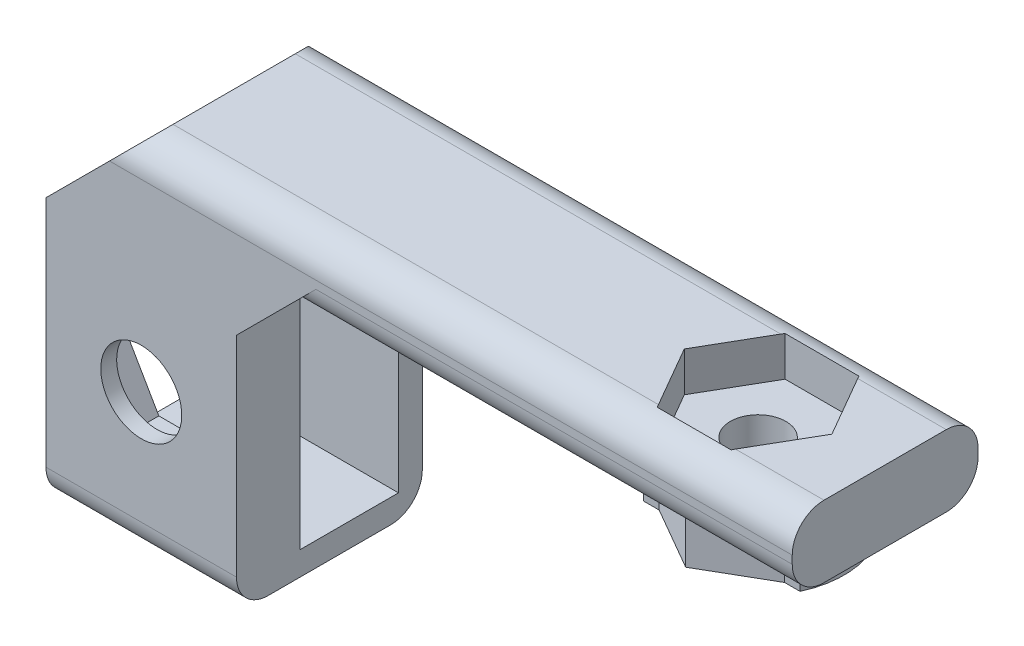
from build123d import *

# Parameters (mm, degrees)
SKETCH1_R           = 1.75
BOSS_EXTRUDE1_DEPTH = 2.8
SKETCH2_W           = 47
SKETCH2_H           = 11.7
BOSS_EXTRUDE2_DEPTH = 4.5
SKETCH2_4_R         = 1.75
BOSS_EXTRUDE3_DEPTH = 2
SKETCH3_W           = 12
SKETCH3_H           = 11.7
BOSS_EXTRUDE4_DEPTH = 18.2
SKETCH4_W           = 6.2
SKETCH4_H           = 15.2
CUT_EXTRUDE2_DEPTH  = 17.2
SKETCH5_R           = 2.55
CUT_EXTRUDE4_DEPTH  = 3
SKETCH5_2_R         = 2.55
CUT_EXTRUDE5_DEPTH  = 43.631561079
FILLET1_R           = 2
CHAMFER1_SIZE       = 3
FILLET2_R           = 2
CHAMFER2_SIZE       = 6


with BuildPart() as part:
    # Sketch1 → Boss-Extrude1 (new body)
    with BuildSketch(Plane(origin=(0, 0, 0), x_dir=(1, 0, 0), z_dir=(0, 1, 0))):
        with BuildLine():
            Line((-3.95, 2.280533563), (-4.922376628, 2.280533563))
            ThreePointArc((-4.922376628, 2.280533563), (-5.425, 0), (-4.922376628, -2.280533563))
            Line((-4.922376628, -2.280533563), (-3.95, -2.280533563))
            Line((-3.95, -2.280533563), (0, -4.561067127))
            Line((0, -4.561067127), (3.95, -2.280533563))
            Line((3.95, -2.280533563), (4.922376628, -2.280533563))
            ThreePointArc((4.922376628, -2.280533563), (5.425, 0), (4.922376628, 2.280533563))
            Line((4.922376628, 2.280533563), (3.95, 2.280533563))
            Line((3.95, 2.280533563), (0, 4.561067127))
            Line((0, 4.561067127), (-3.95, 2.280533563))
        make_face()
        with Locations(Location((0, 0, 0), (0, 0, 270))):
            Circle(SKETCH1_R, mode=Mode.SUBTRACT)
    extrude(amount=BOSS_EXTRUDE1_DEPTH)

    # Sketch2 → Boss-Extrude2 (add)
    with BuildSketch(Plane(origin=(0, 2.8, 0), x_dir=(1, 0, 0), z_dir=(0, 1, 0))):
        with Locations((-15.5, 0)):
            Rectangle(SKETCH2_W, SKETCH2_H)
        Polygon((4.647669667, 0), (2.323834833, 4.025), (-2.323834833, 4.025), (-4.647669667, 0), (-2.323834833, -4.025), (2.323834833, -4.025), align=None, mode=Mode.SUBTRACT)
    extrude(amount=BOSS_EXTRUDE2_DEPTH)

    # Sketch2<4> → Boss-Extrude3 (add)
    # profile 1 of 5: a face of its own
    with BuildSketch(Plane(origin=(0, 2.8, 0), x_dir=(1, 0, 0), z_dir=(0, 1, 0))):
        Polygon((0.9284955, 4.025), (3.0215045, 2.81660069), (2.323834833, 4.025), align=None)
    # profile 2 of 5: a face of its own
    with BuildSketch(Plane(origin=(0, 2.8, 0), x_dir=(1, 0, 0), z_dir=(0, 1, 0))):
        Polygon((3.0215045, -2.81660069), (4.647669667, 0), (3.0215045, 2.81660069), (0.9284955, 4.025), (-0.9284955, 4.025), (-3.0215045, 2.81660069), (-4.647669667, 0), (-3.0215045, -2.81660069), (-0.9284955, -4.025), (0.9284955, -4.025), align=None)
        with Locations(Location((0, 0, 0), (0, 0, 270))):
            Circle(SKETCH2_4_R, mode=Mode.SUBTRACT)
    # profile 3 of 5: a face of its own
    with BuildSketch(Plane(origin=(0, 2.8, 0), x_dir=(1, 0, 0), z_dir=(0, 1, 0))):
        Polygon((2.323834833, -4.025), (3.0215045, -2.81660069), (0.9284955, -4.025), align=None)
    # profile 4 of 5: a face of its own
    with BuildSketch(Plane(origin=(0, 2.8, 0), x_dir=(1, 0, 0), z_dir=(0, 1, 0))):
        Polygon((-2.323834833, -4.025), (-0.9284955, -4.025), (-3.0215045, -2.81660069), align=None)
    # profile 5 of 5: a face of its own
    with BuildSketch(Plane(origin=(0, 2.8, 0), x_dir=(1, 0, 0), z_dir=(0, 1, 0))):
        Polygon((-3.0215045, 2.81660069), (-0.9284955, 4.025), (-2.323834833, 4.025), align=None)
    extrude(amount=BOSS_EXTRUDE3_DEPTH)

    # Sketch3 → Boss-Extrude4 (add)
    with BuildSketch(Plane.XZ.offset(-2.8)):
        with Locations((-33, 0)):
            Rectangle(SKETCH3_W, SKETCH3_H)
    extrude(amount=BOSS_EXTRUDE4_DEPTH)

    # Sketch4 → Cut-Extrude2 (cut)
    with BuildSketch(Plane.ZY.offset(39)):
        with Locations((-1.25, -6.3)):
            Rectangle(SKETCH4_W, SKETCH4_H)
    extrude(amount=-CUT_EXTRUDE2_DEPTH, mode=Mode.SUBTRACT)

    # Sketch5 → Cut-Extrude4 (cut)
    with BuildSketch(Plane(origin=(0, 0, 1.85), x_dir=(-1, 0, 0), z_dir=(0, 0, -1))):
        Polygon((38.634973236, -6.3), (35.892559458, -1.55), (30.4077319, -1.55), (27.665318122, -6.3), (30.4077319, -11.05), (35.892559458, -11.05), align=None)
        with Locations(Location((33, -6.3, 0), (0, 0, 90))):
            Circle(SKETCH5_R, mode=Mode.SUBTRACT)
    extrude(amount=-CUT_EXTRUDE4_DEPTH, mode=Mode.SUBTRACT)

    # Sketch5<2> → Cut-Extrude5 (cut, through all)
    with BuildSketch(Plane(origin=(0, 0, 1.85), x_dir=(-1, 0, 0), z_dir=(0, 0, -1))):
        with Locations(Location((33, -6.3, 0), (0, 0, 90))):
            Circle(SKETCH5_2_R)
    extrude(amount=-CUT_EXTRUDE5_DEPTH, mode=Mode.SUBTRACT)

    # Fillet1
    # the kernel refuses this fillet: 2 mm, written as the material it takes off along each edge
    with BuildSketch(Plane(origin=(-22, -15.4, 5.85), x_dir=(0, 1, 0), z_dir=(-1, 0, 0)), Plane(origin=(-44, -15.4, -5.85), x_dir=(0, 1, 0), z_dir=(1, 0, 0))) as fillet1_piece_1:
        with BuildLine():
            CenterArc((FILLET1_R, FILLET1_R), FILLET1_R, 180, 90)
            Line((0, FILLET1_R), (0, 0))
            Line((0, 0), (FILLET1_R, 0))
        make_face()
    extrude(amount=22, mode=Mode.SUBTRACT)
    with BuildSketch(Plane(origin=(-44, 7.3, 5.85), x_dir=(0, -1, 0), z_dir=(1, 0, 0)), Plane(origin=(13, 7.3, -5.85), x_dir=(0, -1, 0), z_dir=(-1, 0, 0))) as fillet1_piece_2:
        with BuildLine():
            CenterArc((FILLET1_R, FILLET1_R), FILLET1_R, 180, 90)
            Line((0, FILLET1_R), (0, 0))
            Line((0, 0), (FILLET1_R, 0))
        make_face()
    extrude(amount=57, mode=Mode.SUBTRACT)

    # Chamfer1
    # the kernel refuses this chamfer: 3 mm, written as the material it adds along each edge
    with BuildSketch(Plane(origin=(-27, 2.8, -5.85), x_dir=(0.9996219169112968, 0.027495876610586334, 0), z_dir=(0, 0, 1))) as chamfer1_piece_1_section:
        Polygon((CHAMFER1_SIZE * 0.999621916911, -CHAMFER1_SIZE * 0.0274958766106), (-CHAMFER1_SIZE * 0.0274958766106, -CHAMFER1_SIZE * 0.999621916911), (0, 0), align=None)
    chamfer1_piece_1 = extrude(amount=11.7, mode=Mode.PRIVATE)
    chamfer1_piece_1 = split(chamfer1_piece_1, bisect_by=Plane(origin=(-25.819796748, 1.3, -5.1), z_dir=(0, 1, 0)), keep=Keep.TOP, mode=Mode.PRIVATE)
    chamfer1_piece_1 = split(chamfer1_piece_1, bisect_by=Plane(origin=(-25.819796748, 2.175297131, -4.35), z_dir=(0, 0, -1)), keep=Keep.TOP, mode=Mode.PRIVATE)
    add(chamfer1_piece_1)
    with BuildSketch(Plane(origin=(-27, 2.8, -5.85), x_dir=(0.9996219169112968, 0.027495876610586334, 0), z_dir=(0, 0, 1))) as chamfer1_piece_2_section:
        Polygon((CHAMFER1_SIZE * 0.999621916911, -CHAMFER1_SIZE * 0.0274958766106), (-CHAMFER1_SIZE * 0.0274958766106, -CHAMFER1_SIZE * 0.999621916911), (0, 0), align=None)
    chamfer1_piece_2 = extrude(amount=11.7, mode=Mode.PRIVATE)
    chamfer1_piece_2 = split(chamfer1_piece_2, bisect_by=Plane(origin=(-26.56328803, 1.3, -5.1), z_dir=(0, -1, 0)), keep=Keep.TOP, mode=Mode.PRIVATE)
    chamfer1_piece_2 = split(chamfer1_piece_2, bisect_by=Plane(origin=(-26.56328803, 0.754421165, -4.35), z_dir=(0, 0, -1)), keep=Keep.TOP, mode=Mode.PRIVATE)
    add(chamfer1_piece_2)
    with BuildSketch(Plane(origin=(-27, 2.8, -5.85), x_dir=(0.9996219169112968, 0.027495876610586334, 0), z_dir=(0, 0, 1))) as chamfer1_piece_3_section:
        Polygon((CHAMFER1_SIZE * 0.999621916911, -CHAMFER1_SIZE * 0.0274958766106), (-CHAMFER1_SIZE * 0.0274958766106, -CHAMFER1_SIZE * 0.999621916911), (0, 0), align=None)
    chamfer1_piece_3 = extrude(amount=11.7, mode=Mode.PRIVATE)
    chamfer1_piece_3 = split(chamfer1_piece_3, bisect_by=Plane(origin=(-25.819796748, 1.3, -1.25), z_dir=(0, 1, 0)), keep=Keep.TOP, mode=Mode.PRIVATE)
    chamfer1_piece_3 = split(chamfer1_piece_3, bisect_by=Plane(origin=(-25.819796748, 2.175297131, 1.85), z_dir=(0, 0, -1)), keep=Keep.TOP, mode=Mode.PRIVATE)
    chamfer1_piece_3 = split(chamfer1_piece_3, bisect_by=Plane(origin=(-25.819796748, 2.175297131, -4.35), z_dir=(0, 0, 1)), keep=Keep.TOP, mode=Mode.PRIVATE)
    add(chamfer1_piece_3)
    with BuildSketch(Plane(origin=(-27, 2.8, -5.85), x_dir=(0.9996219169112968, 0.027495876610586334, 0), z_dir=(0, 0, 1))) as chamfer1_piece_4_section:
        Polygon((CHAMFER1_SIZE * 0.999621916911, -CHAMFER1_SIZE * 0.0274958766106), (-CHAMFER1_SIZE * 0.0274958766106, -CHAMFER1_SIZE * 0.999621916911), (0, 0), align=None)
    chamfer1_piece_4 = extrude(amount=11.7, mode=Mode.PRIVATE)
    chamfer1_piece_4 = split(chamfer1_piece_4, bisect_by=Plane(origin=(-25.819796748, 1.3, 3.85), z_dir=(0, 1, 0)), keep=Keep.TOP, mode=Mode.PRIVATE)
    chamfer1_piece_4 = split(chamfer1_piece_4, bisect_by=Plane(origin=(-25.819796748, 2.175297131, 1.85), z_dir=(0, 0, 1)), keep=Keep.TOP, mode=Mode.PRIVATE)
    add(chamfer1_piece_4)
    with BuildSketch(Plane(origin=(-27, 2.8, -5.85), x_dir=(0.9996219169112968, 0.027495876610586334, 0), z_dir=(0, 0, 1))) as chamfer1_piece_5_section:
        Polygon((CHAMFER1_SIZE * 0.999621916911, -CHAMFER1_SIZE * 0.0274958766106), (-CHAMFER1_SIZE * 0.0274958766106, -CHAMFER1_SIZE * 0.999621916911), (0, 0), align=None)
    chamfer1_piece_5 = extrude(amount=11.7, mode=Mode.PRIVATE)
    chamfer1_piece_5 = split(chamfer1_piece_5, bisect_by=Plane(origin=(-26.56328803, 1.3, 3.85), z_dir=(0, -1, 0)), keep=Keep.TOP, mode=Mode.PRIVATE)
    chamfer1_piece_5 = split(chamfer1_piece_5, bisect_by=Plane(origin=(-26.56328803, 0.754421165, 1.85), z_dir=(0, 0, 1)), keep=Keep.TOP, mode=Mode.PRIVATE)
    add(chamfer1_piece_5)

    # Fillet2
    # the kernel refuses this fillet: 2 mm, written as the material it takes off along each edge
    with BuildSketch(Plane(origin=(-29, 2.8, 5.85), x_dir=(0, 1, 0), z_dir=(1, 0, 0))) as fillet2_piece_1_section:
        with BuildLine():
            CenterArc((FILLET2_R, -FILLET2_R), FILLET2_R, 90, 90)
            Line((0, -FILLET2_R), (0, 0))
            Line((0, 0), (FILLET2_R, 0))
        make_face()
    fillet2_piece_1 = extrude(amount=42, mode=Mode.PRIVATE)
    fillet2_piece_1 = split(fillet2_piece_1, bisect_by=Plane(origin=(-18.041164539, 8.758835461, 5.380594006), z_dir=(0.7071067811868302, -0.7071067811862648, 0)), keep=Keep.TOP, mode=Mode.PRIVATE)
    fillet2_piece_1 = split(fillet2_piece_1, bisect_by=Plane(origin=(-9.744227799, 3.236820588, 10.186899669), z_dir=(-0.5, 0, -0.8660254037844387)), keep=Keep.TOP, mode=Mode.PRIVATE)
    fillet2_piece_1 = split(fillet2_piece_1, bisect_by=Plane(origin=(-9.034496702, 3.236820588, -0.655001976), z_dir=(-0.4999999999999998, 0, 0.8660254037844388)), keep=Keep.TOP, mode=Mode.PRIVATE)
    add(fillet2_piece_1, mode=Mode.SUBTRACT)
    with BuildSketch(Plane(origin=(-29, 2.8, 5.85), x_dir=(0, 1, 0), z_dir=(1, 0, 0))) as fillet2_piece_2_section:
        with BuildLine():
            CenterArc((FILLET2_R, -FILLET2_R), FILLET2_R, 90, 90)
            Line((0, -FILLET2_R), (0, 0))
            Line((0, 0), (FILLET2_R, 0))
        make_face()
    fillet2_piece_2 = extrude(amount=42, mode=Mode.PRIVATE)
    fillet2_piece_2 = split(fillet2_piece_2, bisect_by=Plane(origin=(-0.44699773, 3.373635394, 4.819141386), z_dir=(0.5, 0, 0.8660254037844387)), keep=Keep.TOP, mode=Mode.PRIVATE)
    fillet2_piece_2 = split(fillet2_piece_2, bisect_by=Plane(origin=(0.44699773, 3.373635394, 4.819141386), z_dir=(-0.4999999999999998, 0, 0.8660254037844388)), keep=Keep.TOP, mode=Mode.PRIVATE)
    add(fillet2_piece_2, mode=Mode.SUBTRACT)
    with BuildSketch(Plane(origin=(-29, 2.8, 5.85), x_dir=(0, 1, 0), z_dir=(1, 0, 0))) as fillet2_piece_3_section:
        with BuildLine():
            CenterArc((FILLET2_R, -FILLET2_R), FILLET2_R, 90, 90)
            Line((0, -FILLET2_R), (0, 0))
            Line((0, 0), (FILLET2_R, 0))
        make_face()
    fillet2_piece_3 = extrude(amount=42, mode=Mode.PRIVATE)
    fillet2_piece_3 = split(fillet2_piece_3, bisect_by=Plane(origin=(5.072316414, 3.23833996, 1.632563879), z_dir=(0.5, 0, 0.8660254037844387)), keep=Keep.TOP, mode=Mode.PRIVATE)
    fillet2_piece_3 = split(fillet2_piece_3, bisect_by=Plane(origin=(5.777120332, 3.23833996, 7.896489105), z_dir=(0.4999999999999998, 0, -0.8660254037844388)), keep=Keep.TOP, mode=Mode.PRIVATE)
    add(fillet2_piece_3, mode=Mode.SUBTRACT)
    with BuildSketch(Plane(origin=(13, 2.8, -5.85), x_dir=(0, 0, 1), z_dir=(-1, 0, 0))) as fillet2_piece_4_section:
        with BuildLine():
            CenterArc((FILLET2_R, FILLET2_R), FILLET2_R, 180, 90)
            Line((0, FILLET2_R), (0, 0))
            Line((0, 0), (FILLET2_R, 0))
        make_face()
    fillet2_piece_4 = extrude(amount=42, mode=Mode.PRIVATE)
    fillet2_piece_4 = split(fillet2_piece_4, bisect_by=Plane(origin=(5.777120334, 3.23833996, -7.896489107), z_dir=(0.49999999999999983, 0, 0.8660254037844388)), keep=Keep.TOP, mode=Mode.PRIVATE)
    fillet2_piece_4 = split(fillet2_piece_4, bisect_by=Plane(origin=(5.072316416, 3.23833996, -1.632563878), z_dir=(0.4999999999999997, 0, -0.866025403784439)), keep=Keep.TOP, mode=Mode.PRIVATE)
    add(fillet2_piece_4, mode=Mode.SUBTRACT)
    with BuildSketch(Plane(origin=(13, 2.8, -5.85), x_dir=(0, 0, 1), z_dir=(-1, 0, 0))) as fillet2_piece_5_section:
        with BuildLine():
            CenterArc((FILLET2_R, FILLET2_R), FILLET2_R, 180, 90)
            Line((0, FILLET2_R), (0, 0))
            Line((0, 0), (FILLET2_R, 0))
        make_face()
    fillet2_piece_5 = extrude(amount=42, mode=Mode.PRIVATE)
    fillet2_piece_5 = split(fillet2_piece_5, bisect_by=Plane(origin=(0.44699773, 3.373635394, -4.819141386), z_dir=(-0.49999999999999983, 0, -0.8660254037844388)), keep=Keep.TOP, mode=Mode.PRIVATE)
    fillet2_piece_5 = split(fillet2_piece_5, bisect_by=Plane(origin=(-0.44699773, 3.373635394, -4.819141386), z_dir=(0.4999999999999997, 0, -0.866025403784439)), keep=Keep.TOP, mode=Mode.PRIVATE)
    add(fillet2_piece_5, mode=Mode.SUBTRACT)
    with BuildSketch(Plane(origin=(13, 2.8, -5.85), x_dir=(0, 0, 1), z_dir=(-1, 0, 0))) as fillet2_piece_6_section:
        with BuildLine():
            CenterArc((FILLET2_R, FILLET2_R), FILLET2_R, 180, 90)
            Line((0, FILLET2_R), (0, 0))
            Line((0, 0), (FILLET2_R, 0))
        make_face()
    fillet2_piece_6 = extrude(amount=42, mode=Mode.PRIVATE)
    fillet2_piece_6 = split(fillet2_piece_6, bisect_by=Plane(origin=(-18.041164541, 8.758835459, -5.380594006), z_dir=(0.7071067811868302, -0.7071067811862648, 0)), keep=Keep.TOP, mode=Mode.PRIVATE)
    fillet2_piece_6 = split(fillet2_piece_6, bisect_by=Plane(origin=(-9.034496704, 3.236820588, 0.655001977), z_dir=(-0.49999999999999983, 0, -0.8660254037844388)), keep=Keep.TOP, mode=Mode.PRIVATE)
    fillet2_piece_6 = split(fillet2_piece_6, bisect_by=Plane(origin=(-9.744227801, 3.236820588, -10.18689967), z_dir=(-0.4999999999999997, 0, 0.866025403784439)), keep=Keep.TOP, mode=Mode.PRIVATE)
    add(fillet2_piece_6, mode=Mode.SUBTRACT)

    # Chamfer2
    # the kernel refuses this chamfer: 6 mm, written as the material it takes off along each edge
    with BuildSketch(Plane(origin=(-39, 7.3, -19.280097928), x_dir=(0.9996219169112968, 0.027495876610586334, 0), z_dir=(0, 0, 1))) as chamfer2_piece_1:
        Polygon((CHAMFER2_SIZE * 0.999621916911, -CHAMFER2_SIZE * 0.0274958766106), (-CHAMFER2_SIZE * 0.0274958766106, -CHAMFER2_SIZE * 0.999621916911), (0, 0), align=None)
    extrude(amount=38.560195856, mode=Mode.SUBTRACT)


solid = part.part
